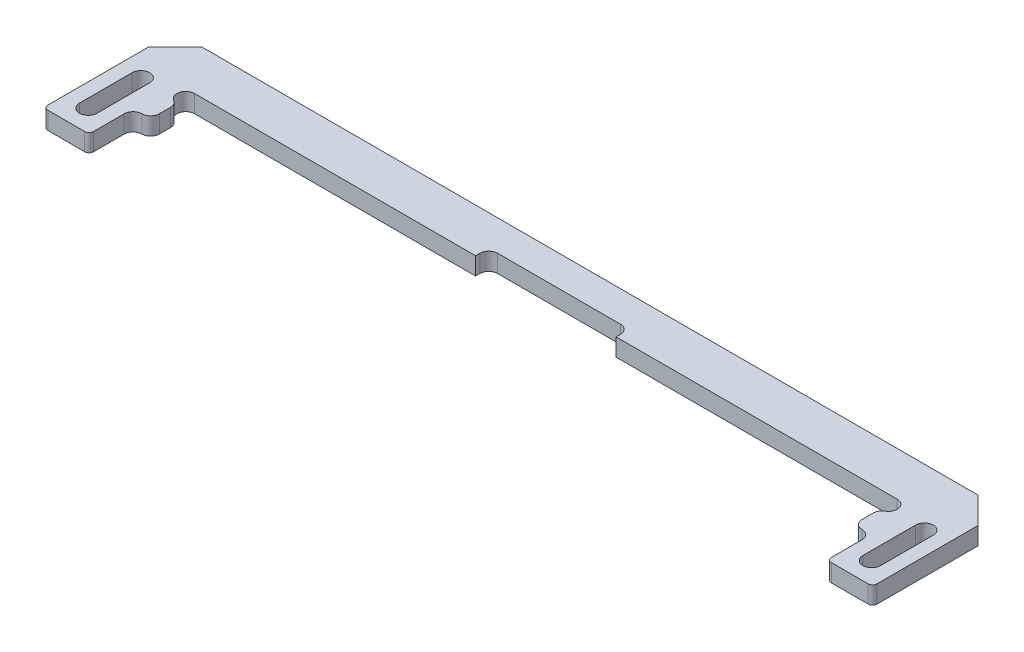
from build123d import *

# Parameters (mm, degrees)
EXTRUDE_1_DEPTH     = 2
SKETCH_3_W          = 2
SKETCH_3_H          = 5
CUT_EXTRUDE_2_DEPTH = 10
CHAMFER_1_SIZE      = 3
SKETCH_4_W          = 16
SKETCH_4_H          = 3
CUT_EXTRUDE_3_DEPTH = 2
FILLET_1_R          = 1
FILLET_START        = -1
FILLET_2_DEPTH      = 4
FILLET_2_2_DEPTH    = 2
FILLET_3_R          = 0.5
CUT_EXTRUDE_4_DEPTH = 10
SKETCH_7_R          = 1
CUT_EXTRUDE_6_DEPTH = 10
FILLET_5_R          = 1


with BuildPart() as part:
    # 草图1 → 凸台-拉伸1 (new body)
    with BuildSketch(Plane(origin=(0, 0, 0), x_dir=(1, 0, 0), z_dir=(0, 1, 0))):
        Polygon((40, -10), (40, 0), (0, 0), (0, 5), (47.2, 5), (47.2, 0), (47.2, -10), align=None)
    extrude_1 = extrude(amount=EXTRUDE_1_DEPTH)

    # 草图3 → 切除-拉伸2 (cut)
    with BuildSketch(Plane.XZ):
        with Locations((41, 7.5)):
            Rectangle(SKETCH_3_W, SKETCH_3_H)
    cut_extrude_2 = extrude(amount=-CUT_EXTRUDE_2_DEPTH, mode=Mode.SUBTRACT)

    # 镜向1: 凸台-拉伸1, 切除-拉伸2 across plane
    add(extrude_1.mirror(Plane(origin=(0, 0, 0), x_dir=(0, 0, 1), z_dir=(1, 0, 0))))
    add(cut_extrude_2.mirror(Plane(origin=(0, 0, 0), x_dir=(0, 0, 1), z_dir=(1, 0, 0))), mode=Mode.SUBTRACT)

    # 倒角1
    chamfer_1_edges = [part.edges().sort_by_distance(p)[0] for p in [
        (47.2, 1, -5),
        (-47.2, 1, -5),
    ]]
    chamfer(chamfer_1_edges, length=CHAMFER_1_SIZE)

    # 草图4 → 切除-拉伸3 (cut)
    with BuildSketch(Plane.XZ):
        Rectangle(SKETCH_4_W, SKETCH_4_H)
    extrude(amount=-CUT_EXTRUDE_3_DEPTH, mode=Mode.SUBTRACT)

    # 圆角1
    fillet_1_edges = [part.edges().sort_by_distance(p)[0] for p in [
        (-8, 1, -1.5),
        (8, 1, -1.5),
    ]]
    fillet(fillet_1_edges, radius=FILLET_1_R)

    # 圆角2: read off the stored shape, not the designer's step
    # 圆角2 outline → 圆角2 (cut)
    with BuildSketch(Plane(origin=(0, 0, 0), x_dir=(1, 0, 0), z_dir=(0, 1, 0)).offset(FILLET_START)):
        with BuildLine():
            Line((-40, -5), (-40, -4))
            ThreePointArc((-40, -4), (-40.292893219, -4.707106781), (-41, -5))
            Line((-41, -5), (-40, -5))
        make_face()
        with BuildLine():
            Line((40, -5), (41, -5))
            ThreePointArc((41, -5), (40.292893219, -4.707106781), (40, -4))
            Line((40, -4), (40, -5))
        make_face()
    extrude(amount=FILLET_2_DEPTH, mode=Mode.SUBTRACT)

    # Fillet 2 2 outline → Fillet 2 2 (add)
    with BuildSketch(Plane(origin=(0, 0, 0), x_dir=(1, 0, 0), z_dir=(0, 1, 0))):
        with BuildLine():
            ThreePointArc((-42, -6), (-41.707106781, -5.292893219), (-41, -5))
            Line((-41, -5), (-42, -5))
            Line((-42, -5), (-42, -6))
        make_face()
        with BuildLine():
            ThreePointArc((41, -5), (41.707106781, -5.292893219), (42, -6))
            Line((42, -6), (42, -5))
            Line((42, -5), (41, -5))
        make_face()
    extrude(amount=FILLET_2_2_DEPTH)

    # 圆角3
    fillet_3_edges = [part.edges().sort_by_distance(p)[0] for p in [
        (47.2, 1, 10),
        (42, 1, 10),
        (-47.2, 1, 10),
        (-42, 1, 10),
    ]]
    fillet(fillet_3_edges, radius=FILLET_3_R)

    # 草图5 → 切除-拉伸4 (cut)
    with BuildSketch(Plane.XZ):
        with BuildLine():
            Line((43.6, 1.5), (43.6, 7.5))
            ThreePointArc((43.6, 7.5), (44.6, 8.5), (45.6, 7.5))
            Line((45.6, 7.5), (45.6, 1.5))
            ThreePointArc((45.6, 1.5), (44.6, 0.5), (43.6, 1.5))
        make_face()
    cut_extrude_4 = extrude(amount=-CUT_EXTRUDE_4_DEPTH, mode=Mode.SUBTRACT)

    # 镜向2: 切除-拉伸4 across plane
    add(cut_extrude_4.mirror(Plane(origin=(0, 0, 0), x_dir=(0, 0, 1), z_dir=(1, 0, 0))), mode=Mode.SUBTRACT)

    # 草图7 → 切除-拉伸6 (cut)
    with BuildSketch(Plane.XZ):
        with Locations((40, 1)):
            Circle(SKETCH_7_R)
        with Locations((-40, 1)):
            Circle(SKETCH_7_R)
    extrude(amount=-CUT_EXTRUDE_6_DEPTH, mode=Mode.SUBTRACT)

    # 圆角5
    fillet_5_edges = [part.edges().sort_by_distance(p)[0] for p in [
        (40, 1, 2),
        (-40, 1, 2),
    ]]
    fillet(fillet_5_edges, radius=FILLET_5_R)


solid = part.part
